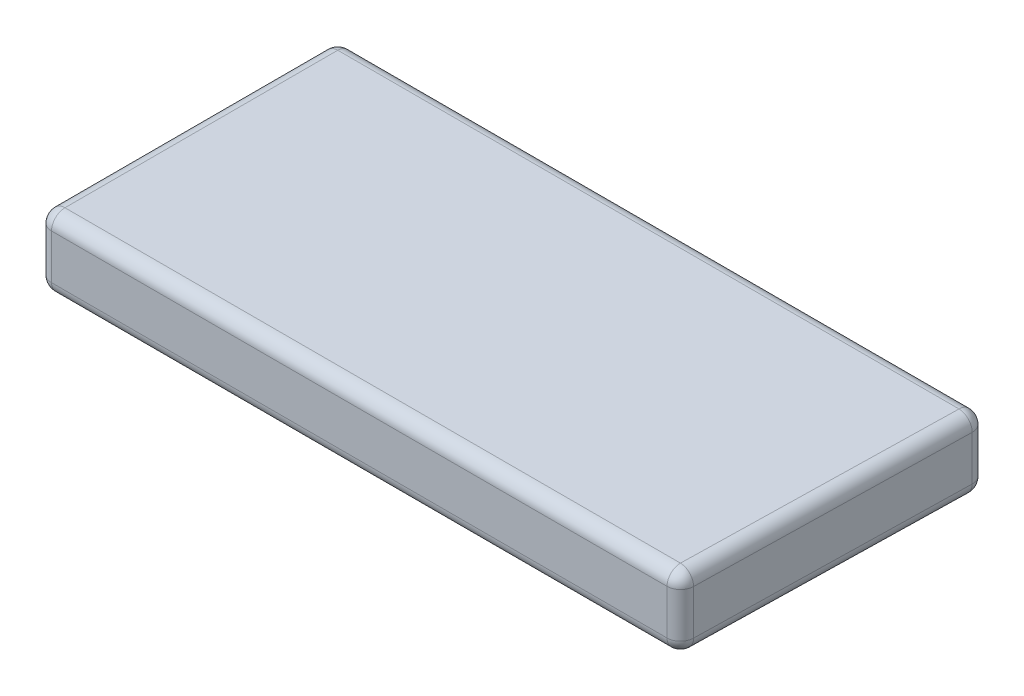
from build123d import *

# Parameters (mm, degrees)
BOSS_EXTRUDE2_DEPTH      = 8
BOSS_EXTRUDE2_DEPTH_BACK = 8
SKETCH3_W                = 12.5
SKETCH3_H                = 5
SKETCH3_W_2              = 8.94
SKETCH3_H_2              = 3.21
CUT_EXTRUDE1_DEPTH       = 16
FILLET1_R                = 3
FILLET2_R                = 1
FILLET3_R                = 1.25


with BuildPart() as part:
    # Sketch2 → Boss-Extrude2 (new, two sides: drawn at the far end of the back side and taken through both)
    with BuildSketch(Plane(origin=(0, 0, 0), x_dir=(1, 0, 0), z_dir=(0, 1, 0)).offset(-BOSS_EXTRUDE2_DEPTH_BACK)):
        Polygon((-72.495595293, -0.799164043), (-72.495595293, 33.5), (72.495595293, 33.5), (71.070165431, -33.5), (-72.495595293, -33.5), align=None)
    extrude(amount=BOSS_EXTRUDE2_DEPTH + BOSS_EXTRUDE2_DEPTH_BACK)

    # Sketch3 → Cut-Extrude1 (cut)
    with BuildSketch(Plane.ZY.offset(72.495595293)):
        with Locations((-17.25, 0.071666465)):
            Rectangle(SKETCH3_W, SKETCH3_H)
        with Locations((17.25, 0.071666465)):
            Rectangle(SKETCH3_W, SKETCH3_H)
        Rectangle(SKETCH3_W_2, SKETCH3_H_2)
    extrude(amount=-CUT_EXTRUDE1_DEPTH, mode=Mode.SUBTRACT)

    # Fillet1
    fillet1_edges = [part.edges().sort_by_distance(p)[0] for p in [
        (72.495595293, 0, -33.5),
        (0, 8, -33.5),
        (-72.495595293, 0, -33.5),
        (71.782880362, -8, 0),
        (0, -8, -33.5),
        (-72.495595293, -8, 0),
        (-0.712714931, -8, 33.5),
        (-72.495595293, 0, 33.5),
        (-0.712714931, 8, 33.5),
        (71.070165431, 0, 33.5),
        (71.782880362, 8, 0),
        (-72.495595293, 8, 0),
    ]]
    fillet(fillet1_edges, radius=FILLET1_R)

    # Fillet2
    fillet2_edges = [part.edges().sort_by_distance(p)[0] for p in [
        (-72.495595293, 0.071666465, 11),
        (-72.495595293, 2.571666465, 17.25),
        (-72.495595293, 0.071666465, 23.5),
        (-72.495595293, -2.428333535, 17.25),
        (-72.495595293, -2.428333535, -17.25),
        (-72.495595293, 0.071666465, -23.5),
        (-72.495595293, 2.571666465, -17.25),
        (-72.495595293, 0.071666465, -11),
    ]]
    fillet(fillet2_edges, radius=FILLET2_R)

    # Fillet3
    fillet3_edges = [part.edges().sort_by_distance(p)[0] for p in [
        (-72.495595293, 1.605, 0),
        (-72.495595293, 0, -4.47),
        (-72.495595293, -1.605, 0),
        (-72.495595293, 0, 4.47),
        (-64.495595293, 1.605, -4.47),
        (-56.495595293, 0, -4.47),
        (-64.495595293, -1.605, -4.47),
        (-56.495595293, -1.605, 0),
        (-64.495595293, -1.605, 4.47),
        (-64.495595293, 1.605, 4.47),
    ]]
    fillet(fillet3_edges, radius=FILLET3_R)


solid = part.part
